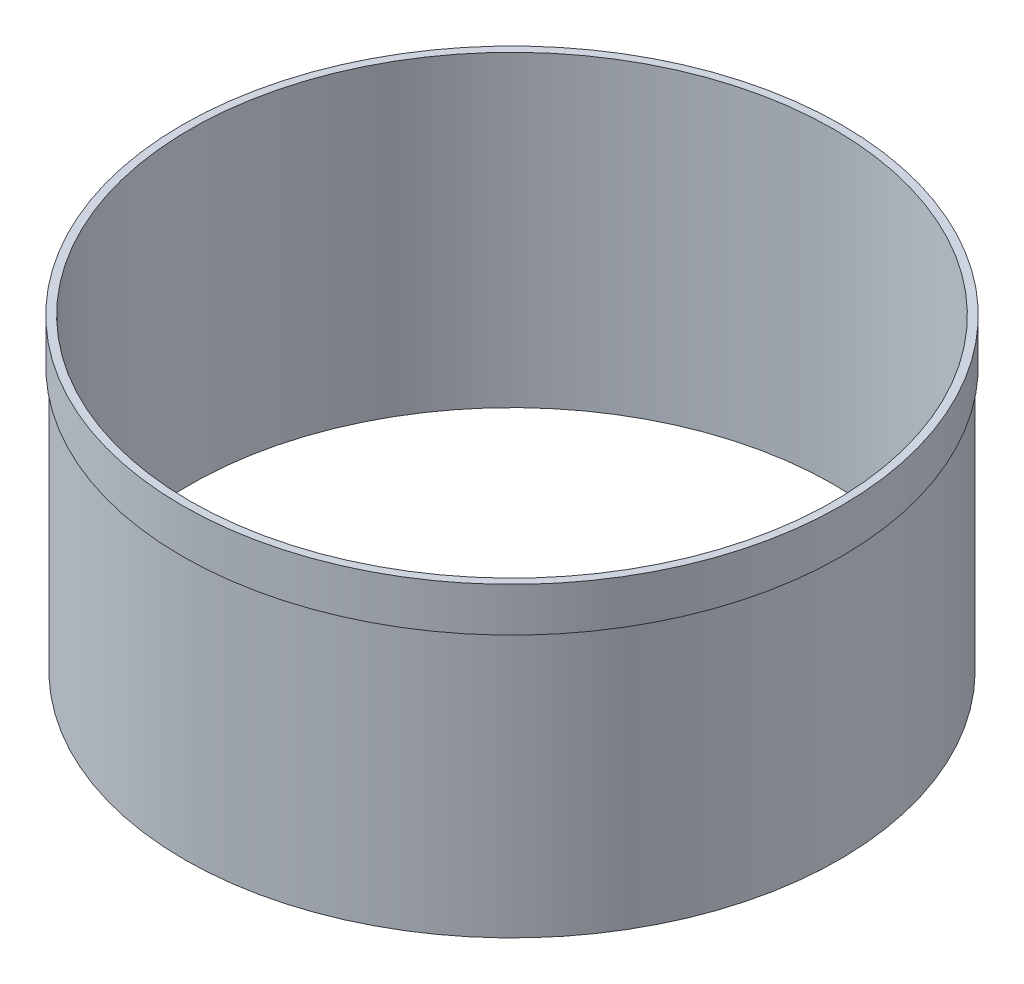
from build123d import *

# Parameters (mm, degrees)
SKETCH1_R           = 94.615
SKETCH1_R_2         = 93.0275
BOSS_EXTRUDE1_DEPTH = 88.9
BOSS_EXTRUDE2_START = -12.7
SKETCH2_R           = 95.25
SKETCH2_R_2         = 94.615
BOSS_EXTRUDE2_DEPTH = 12.7


with BuildPart() as part:
    # Sketch1 → Boss-Extrude1 (new body)
    with BuildSketch(Plane(origin=(0, 0, 0), x_dir=(1, 0, 0), z_dir=(0, 1, 0))):
        Circle(SKETCH1_R)
        Circle(SKETCH1_R_2, mode=Mode.SUBTRACT)
    extrude(amount=BOSS_EXTRUDE1_DEPTH)

    # Sketch2 → Boss-Extrude2 (add)
    with BuildSketch(Plane(origin=(0, 88.9, 0), x_dir=(1, 0, 0), z_dir=(0, 1, 0)).offset(BOSS_EXTRUDE2_START)):
        Circle(SKETCH2_R)
        Circle(SKETCH2_R_2, mode=Mode.SUBTRACT)
    extrude(amount=BOSS_EXTRUDE2_DEPTH)


solid = part.part
